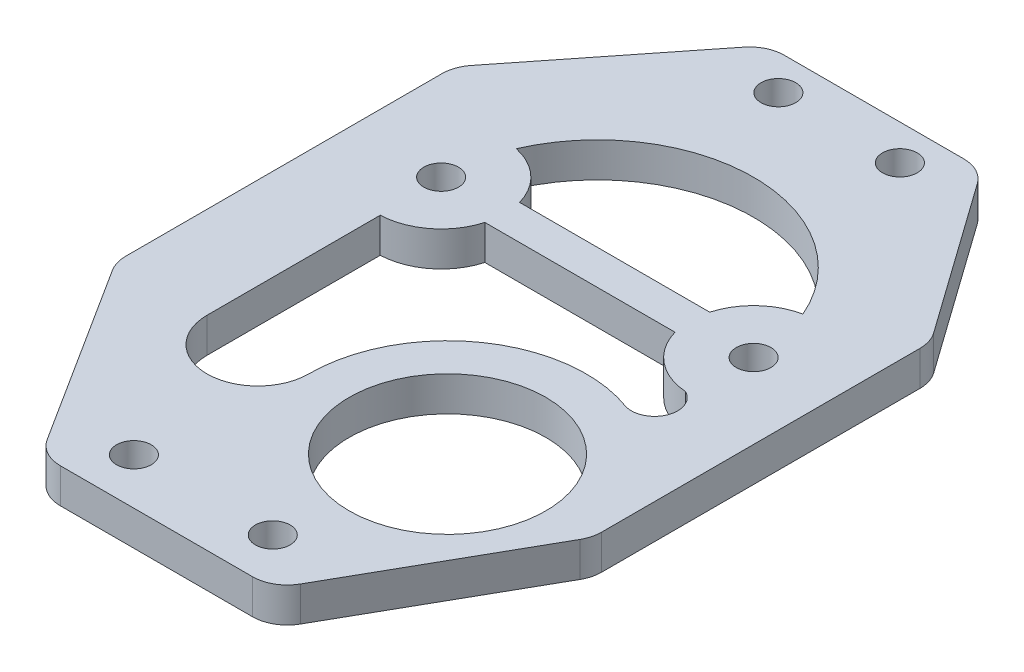
from build123d import *

# Parameters (mm, degrees)
SKETCH1_R          = 8.5
SKETCH1_R_2        = 1.5
BASE_FLANGE1_DEPTH = 3
L_EK1_SCALE        = 2


# Sheet-metal steps are written as plain solids
with BuildPart() as part:
    # Sketch1 → Base-Flange1 (new body)
    with BuildSketch(Plane(origin=(0, 0, 0), x_dir=(1, 0, 0), z_dir=(0, 1, 0))):
        with BuildLine():
            Line((19.609421573, -14.059417906), (10.862109445, -29.480175346))
            ThreePointArc((10.862109445, -29.480175346), (9.762567662, -30.59234701), (8.252687872, -31))
            Line((8.252687872, -31), (-8.352599575, -31))
            ThreePointArc((-8.352599575, -31), (-9.796606082, -30.629609326), (-10.884048227, -29.609896806))
            Line((-10.884048227, -29.609896806), (-20.742852548, -14.107625594))
            ThreePointArc((-20.742852548, -14.107625594), (-21.091885276, -13.336076582), (-21.211403896, -12.497728788))
            Line((-21.211403896, -12.497728788), (-21.211403896, 14.839305313))
            ThreePointArc((-21.211403896, 14.839305313), (-21.044943633, 15.824725306), (-20.564035521, 16.700789784))
            Line((-20.564035521, 16.700789784), (-10.150833328, 29.861484472))
            ThreePointArc((-10.150833328, 29.861484472), (-9.105019706, 30.700412322), (-7.798201703, 31))
            Line((-7.798201703, 31), (7.702138241, 31))
            ThreePointArc((7.702138241, 31), (9.077698333, 30.666052219), (10.147014932, 29.738556288))
            Line((10.147014932, 29.738556288), (19.444876691, 16.663267527))
            ThreePointArc((19.444876691, 16.663267527), (19.857851472, 15.837226972), (20, 14.924711239))
            Line((20, 14.924711239), (20, -12.57924256))
            ThreePointArc((20, -12.57924256), (19.900712388, -13.344662472), (19.609421573, -14.059417906))
        make_face()
        with Locations(Location((7.5, -13.4, 0), (0, 0, 270))):
            Circle(SKETCH1_R, mode=Mode.SUBTRACT)
        with Locations(Location((6, -27, 0), (0, 0, 270))):
            Circle(SKETCH1_R_2, mode=Mode.SUBTRACT)
        with Locations(Location((-6, -27, 0), (0, 0, 270))):
            Circle(SKETCH1_R_2, mode=Mode.SUBTRACT)
        with Locations(Location((5.25, 27.940782939, 0), (0, 0, 270))):
            Circle(SKETCH1_R_2, mode=Mode.SUBTRACT)
        with Locations(Location((-5.25, 27.940782939, 0), (0, 0, 270))):
            Circle(SKETCH1_R_2, mode=Mode.SUBTRACT)
        with Locations(Location((13.5, 7.05, 0), (0, 0, 270))):
            Circle(SKETCH1_R_2, mode=Mode.SUBTRACT)
        with Locations(Location((-13.5, 7.05, 0), (0, 0, 270))):
            Circle(SKETCH1_R_2, mode=Mode.SUBTRACT)
        with BuildLine():
            Line((-13.281403896, 0), (-13.281403896, 1.567980996))
            ThreePointArc((-13.281403896, 1.567980996), (-10.106558233, 2.738982767), (-8.222660082, 5.55))
            Line((-8.222660082, 5.55), (8.208497378, 5.55))
            ThreePointArc((8.208497378, 5.55), (10.031018679, 2.781959631), (13.113110627, 1.563624456))
            ThreePointArc((13.113110627, 1.563624456), (14.07117407, -0.953003234), (11.655254401, -2.142386538))
            ThreePointArc((11.655254401, -2.142386538), (0.639353267, -3.554619032), (-4.5, -13.4))
            ThreePointArc((-4.5, -13.4), (-8.890701948, -17.790701948), (-13.281403896, -13.4))
            Line((-13.281403896, -13.4), (-13.281403896, 0))
        make_face(mode=Mode.SUBTRACT)
        with BuildLine():
            Line((-8.222660082, 8.55), (8.208497378, 8.55))
            ThreePointArc((8.208497378, 8.55), (9.751572067, 11.074833914), (12.37962963, 12.434679214))
            ThreePointArc((12.37962963, 12.434679214), (-0.006957749, 20.549998207), (-12.385173459, 12.42191571))
            ThreePointArc((-12.385173459, 12.42191571), (-9.763306163, 11.067142739), (-8.222660082, 8.55))
        make_face(mode=Mode.SUBTRACT)
    extrude(amount=BASE_FLANGE1_DEPTH)


with BuildPart() as part_1:
    # Ölçek1: scaled about (-1.130925292, 1.5, -0.876080417)
    add(part.part.scale(L_EK1_SCALE).moved(Location((1.130925292, -1.5, 0.876080417))))


solid = part_1.part
